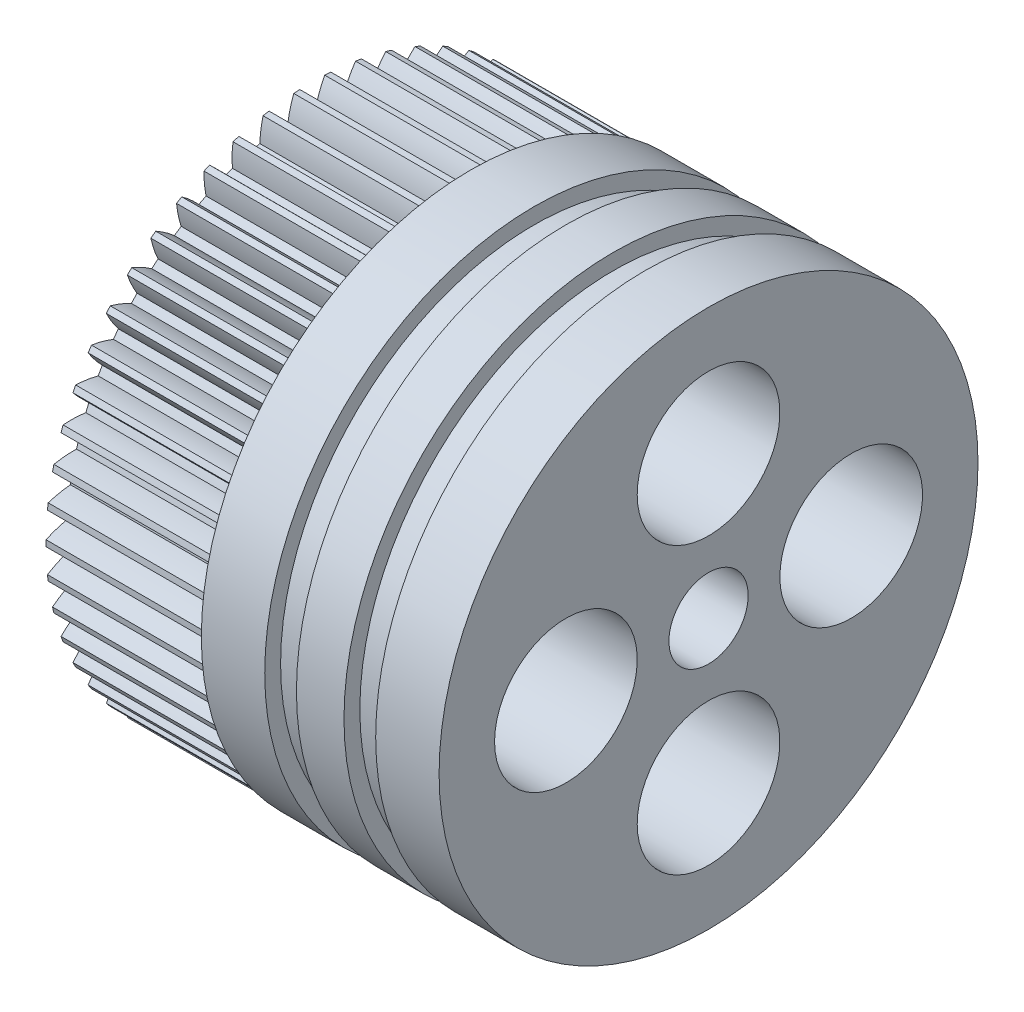
from build123d import *

# Parameters (mm, degrees)
BASPROSKE_W         = 10
BASPROSKE_H         = 16.8
TOOTHCUT_DEPTH      = 26.777509577
TEETHCUTS_COUNT     = 54
TEETHCUTS_ANGLE     = 353.333333333
BORSKE_R            = 2
BORE_DEPTH          = 50.0013716
BOSS_EXTRUDE1_START = 15
SKETCH1_R           = 17
SKETCH1_R_2         = 2
BOSS_EXTRUDE1_DEPTH = 15
SKETCH2_R           = 2.5
CUT_EXTRUDE1_DEPTH  = 5
SKETCH3_R           = 4.5
CUT_EXTRUDE2_DEPTH  = 35.684290392
SKETCH4_W           = 2
SKETCH4_H           = 1


with BuildPart() as part:
    # BasProSke → Base-Revolve (revolve)
    with BuildSketch(Plane(origin=(0, 0, 0), x_dir=(1, 0, 0), z_dir=(0, 1, 0))):
        with Locations((5, 8.4)):
            Rectangle(BASPROSKE_W, BASPROSKE_H)
    revolve(axis=Axis((-10, 0, 0), (1, 0, 0)))

    # TooCutSke → ToothCut (cut, through all)
    with BuildSketch(Plane(origin=(0, 0, 0), x_dir=(0, 0, -1), z_dir=(1, 0, 0))):
        with BuildLine():
            ThreePointArc((0.260831852, 15.446797977), (0, 15.449), (-0.260831852, 15.446797977))
            ThreePointArc((-0.260831852, 15.446797977), (-0.491357596, 16.141835381), (-0.798828381, 16.806426104))
            ThreePointArc((-0.798828381, 16.806426104), (0, 16.8254), (0.798828381, 16.806426104))
            ThreePointArc((0.798828381, 16.806426104), (0.491357596, 16.141835381), (0.260831852, 15.446797977))
        make_face()
    toothcut = extrude(amount=TOOTHCUT_DEPTH, mode=Mode.SUBTRACT)

    # TeethCuts: ToothCut ×54 about axis
    teethcuts_axis = Axis((-10, 0, 0), (1, 0, 0))
    for i in range(1, TEETHCUTS_COUNT):
        add(toothcut.rotate(teethcuts_axis, i * TEETHCUTS_ANGLE / (TEETHCUTS_COUNT - 1)), mode=Mode.SUBTRACT)

    # BorSke → Bore (cut, symmetric)
    with BuildSketch(Plane(origin=(0, 0, 0), x_dir=(0, 0, -1), z_dir=(1, 0, 0))):
        Circle(BORSKE_R)
    extrude(amount=BORE_DEPTH, both=True, mode=Mode.SUBTRACT)

    # Sketch1 → Boss-Extrude1 (add)
    with BuildSketch(Plane(origin=(10, 0, 0), x_dir=(0, 0, -1), z_dir=(1, 0, 0)).offset(BOSS_EXTRUDE1_START)):
        Circle(SKETCH1_R)
        Circle(SKETCH1_R_2, mode=Mode.SUBTRACT)
    extrude(amount=-BOSS_EXTRUDE1_DEPTH)

    # Sketch2 → Cut-Extrude1 (cut)
    with BuildSketch(Plane(origin=(25, 0, 0), x_dir=(0, 0, -1), z_dir=(1, 0, 0))):
        Circle(SKETCH2_R)
    extrude(amount=-CUT_EXTRUDE1_DEPTH, mode=Mode.SUBTRACT)

    # Sketch3 → Cut-Extrude2 (cut, through all)
    with BuildSketch(Plane.ZY):
        with Locations((0, 9)):
            Circle(SKETCH3_R)
        with Locations((9, 0)):
            Circle(SKETCH3_R)
        with Locations((0, -9)):
            Circle(SKETCH3_R)
        with Locations((-9, 0)):
            Circle(SKETCH3_R)
    extrude(amount=-CUT_EXTRUDE2_DEPTH, mode=Mode.SUBTRACT)

    # Sketch4 → Cut-Revolve1 (revolve, cut)
    with BuildSketch(Plane.XY):
        with Locations((15, 16.5)):
            Rectangle(SKETCH4_W, SKETCH4_H)
        with Locations((20, 16.5)):
            Rectangle(SKETCH4_W, SKETCH4_H)
    revolve(axis=Axis((20, 0, 0), (-1, 0, 0)), mode=Mode.SUBTRACT)


solid = part.part
